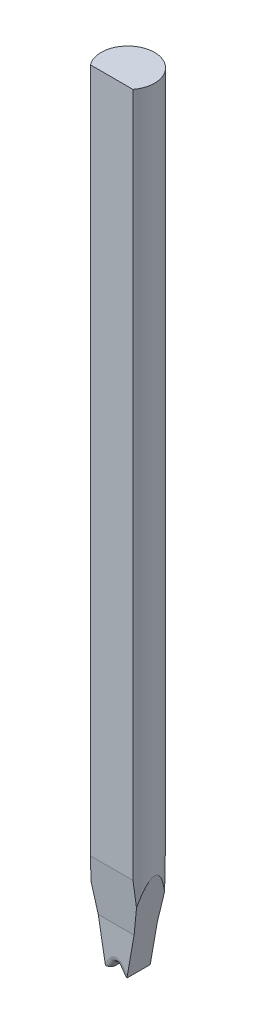
from build123d import *

# Parameters (mm, degrees)
SKETCH_TL_CUTTING_R       = 0.99695
TL_CUTTING_DEPTH          = 29.0068
SKETCH_TDF_GRINDING_W     = 2.0139
SKETCH_TDF_GRINDING_H     = 2.0139
TDF_GRINDING_DEPTH        = 30.041044486
ENGRAVING_DEPTH           = 0.005
VW_VR_GRINDING_DEPTH      = 1.00695
VW_VR_GRINDING_DEPTH_BACK = 1.00695
ISA_GRINDING_DEPTH        = 1.00695
ISA_GRINDING_DEPTH_BACK   = 1.00695
PRE_FRX_BRX_DEPTH         = 1.00695
PRE_FRX_BRX_DEPTH_BACK    = 1.00695
SKETCH_PRE_FRX_BRX_W      = 0.57134
SKETCH_PRE_FRX_BRX_H      = 1.524
FR_EDM_R                  = 0.20066
BR_EDM_R                  = 0.20066
FA_BA_GRINDING_DEPTH      = 1.00695
FA_BA_GRINDING_DEPTH_BACK = 1.00695


with BuildPart() as part:
    # sketch_TL_cutting → TL_cutting (new body)
    with BuildSketch(Plane(origin=(0, 0, 0), x_dir=(1, 0, 0), z_dir=(0, 1, 0))):
        Circle(SKETCH_TL_CUTTING_R)
    extrude(amount=TL_CUTTING_DEPTH)

    # sketch_TDF_grinding → TDF_grinding (cut, through all)
    with BuildSketch(Plane(origin=(0, 0, 0), x_dir=(1, 0, 0), z_dir=(0, 1, 0))):
        with Locations((0, -1.6102)):
            Rectangle(SKETCH_TDF_GRINDING_W, SKETCH_TDF_GRINDING_H)
    extrude(amount=TDF_GRINDING_DEPTH, mode=Mode.SUBTRACT)

    # sketch_engraving → engraving (cut)
    # profile 1 of 4: a face of its own
    with BuildSketch(Plane.XY.offset(0.60325)):
        with BuildLine():
            Line((-0.871794872, -2.249610256), (-0.807692308, -2.057302564))
            add(Edge.make_bspline(
                [(-0.807692308, -2.057302564), (-0.795083199, -2.06121087), (-0.770390599, -2.068864563), (-0.734999856, -2.082917641), (-0.702203082, -2.098988566), (-0.671609756, -2.116493058), (-0.6440337, -2.136542577), (-0.618512481, -2.157904321), (-0.595846404, -2.18153144), (-0.575501226, -2.206851949), (-0.557609249, -2.234023228), (-0.542137322, -2.262995768), (-0.529122858, -2.293719832), (-0.518507427, -2.326238118), (-0.510028384, -2.360428836), (-0.504422472, -2.396434221), (-0.500623034, -2.434090947), (-0.50021097, -2.459803301), (-0.5, -2.472967628)],
                knots=[0, 0, 0, 0, 1.126731846, 2.206495396, 3.246709377, 4.243024494, 5.211217468, 6.153555546, 7.080823308, 8.001390448, 8.923174699, 9.854062736, 10.801713968, 11.767975006, 12.771764216, 13.805490997, 14.876445307, 16, 16, 16, 16], degree=3))
            add(Edge.make_bspline(
                [(-0.5, -2.472967628), (-0.500335891, -2.489216381), (-0.500996599, -2.521178163), (-0.507650823, -2.567918239), (-0.518025882, -2.612463234), (-0.532414864, -2.654859055), (-0.551397758, -2.694919282), (-0.574583683, -2.732730686), (-0.601797497, -2.768403052), (-0.632954709, -2.801556323), (-0.667737286, -2.831589127), (-0.705863815, -2.857840981), (-0.747111378, -2.879847677), (-0.791322431, -2.898010762), (-0.838654677, -2.9120057), (-0.889022656, -2.921872894), (-0.942422085, -2.928033707), (-0.979015843, -2.928736665), (-0.997796474, -2.929097436)],
                knots=[0, 0, 0, 0, 1.025143361, 2.016487647, 2.973470535, 3.909229238, 4.836912068, 5.765858094, 6.70417655, 7.664375231, 8.632718049, 9.599637839, 10.580278406, 11.578303177, 12.611869726, 13.690654642, 14.814798883, 16, 16, 16, 16], degree=3))
            add(Edge.make_bspline(
                [(-0.997796474, -2.929097436), (-1.017578527, -2.928738492), (-1.056169701, -2.928038259), (-1.112278886, -2.921863082), (-1.165155112, -2.912269636), (-1.214486066, -2.898197789), (-1.260619603, -2.880395166), (-1.303180538, -2.858312512), (-1.342406952, -2.832257423), (-1.378079579, -2.802485518), (-1.409638387, -2.769166779), (-1.437292633, -2.733358276), (-1.460718252, -2.695027092), (-1.479834361, -2.654102914), (-1.494642319, -2.610629436), (-1.505301296, -2.564674908), (-1.511506444, -2.516206506), (-1.512376497, -2.483068233), (-1.512820513, -2.466156731)],
                knots=[0, 0, 0, 0, 1.21258364, 2.365529433, 3.456816616, 4.503979614, 5.50606293, 6.48392428, 7.437774563, 8.388174149, 9.326458891, 10.246094529, 11.157518439, 12.075155987, 13.009968439, 13.968342023, 14.963181076, 16, 16, 16, 16], degree=3))
            add(Edge.make_bspline(
                [(-1.512820513, -2.466156731), (-1.512450536, -2.451386542), (-1.511725146, -2.42242762), (-1.506737219, -2.380032682), (-1.498143416, -2.339787486), (-1.486006252, -2.301738502), (-1.470888062, -2.265621156), (-1.45186339, -2.231865567), (-1.429612214, -2.200072504), (-1.412207335, -2.180924346), (-1.403445513, -2.171284936)],
                knots=[0, 0, 0, 0, 1.098573301, 2.153899152, 3.169959448, 4.154852821, 5.120726819, 6.076884781, 7.031881026, 8, 8, 8, 8], degree=3))
            add(Edge.make_bspline(
                [(-1.403445513, -2.171284936), (-1.397871829, -2.165696913), (-1.386593541, -2.154389607), (-1.367544628, -2.139304562), (-1.3470244, -2.124912925), (-1.324614076, -2.111796601), (-1.300431258, -2.099741822), (-1.274575858, -2.088805886), (-1.246999061, -2.078651885), (-1.227800808, -2.073015524), (-1.217948718, -2.070123077)],
                knots=[0, 0, 0, 0, 0.885321605, 1.791438769, 2.723025903, 3.697505786, 4.703199598, 5.754404901, 6.847613555, 8, 8, 8, 8], degree=3))
            Line((-1.217948718, -2.070123077), (-1.179487179, -2.262430769))
            add(Edge.make_bspline(
                [(-1.179487179, -2.262430769), (-1.185794883, -2.264065306), (-1.198219404, -2.267284913), (-1.216072758, -2.273799351), (-1.233013997, -2.281271926), (-1.24862817, -2.290533497), (-1.263609908, -2.300371681), (-1.277293975, -2.312019535), (-1.290039001, -2.324733187), (-1.301712723, -2.338604224), (-1.312079256, -2.353467283), (-1.321398123, -2.369036198), (-1.329005231, -2.385593939), (-1.335159363, -2.402920249), (-1.34031914, -2.420946119), (-1.343506574, -2.439832032), (-1.345953493, -2.459415783), (-1.346086083, -2.472758886), (-1.346153846, -2.479578205)],
                knots=[0, 0, 0, 0, 1.051226935, 2.070641259, 3.064374968, 4.034983734, 4.997599858, 5.953980297, 6.92954377, 7.901109626, 8.875958313, 9.851998019, 10.826131395, 11.811470594, 12.818270757, 13.847890818, 14.900111925, 16, 16, 16, 16], degree=3))
            add(Edge.make_bspline(
                [(-1.346153846, -2.479578205), (-1.345964714, -2.488943276), (-1.345595586, -2.507221091), (-1.341480052, -2.533936919), (-1.335736399, -2.559400139), (-1.326965871, -2.58350806), (-1.315748437, -2.606111388), (-1.302112392, -2.62746701), (-1.286116143, -2.647457717), (-1.267570186, -2.666090263), (-1.246139201, -2.682810441), (-1.221778941, -2.697509865), (-1.194212839, -2.709704354), (-1.163711404, -2.71960434), (-1.130202104, -2.727396757), (-1.093641961, -2.732961156), (-1.054005964, -2.736038436), (-1.026581026, -2.736533904), (-1.012419872, -2.736789744)],
                knots=[0, 0, 0, 0, 0.938194206, 1.831074359, 2.704771284, 3.551924377, 4.396294915, 5.230222094, 6.087631332, 6.958733431, 7.860107878, 8.806247581, 9.804197948, 10.875520245, 12.017191412, 13.250061517, 14.580040491, 16, 16, 16, 16], degree=3))
            add(Edge.make_bspline(
                [(-1.012419872, -2.736789744), (-0.997391019, -2.736536242), (-0.968432733, -2.736047784), (-0.926662344, -2.73297356), (-0.888247277, -2.727365436), (-0.853169898, -2.719717346), (-0.821424949, -2.70970431), (-0.792995162, -2.697493429), (-0.767732206, -2.683211745), (-0.746067503, -2.666272713), (-0.727378117, -2.647679633), (-0.711056153, -2.627854408), (-0.697322329, -2.606598135), (-0.685986727, -2.584069326), (-0.677425368, -2.560082675), (-0.671212847, -2.534852544), (-0.667264371, -2.508281648), (-0.666868694, -2.490075783), (-0.666666667, -2.480780128)],
                knots=[0, 0, 0, 0, 1.475358314, 2.842788217, 4.10813974, 5.28337307, 6.36340737, 7.370420267, 8.315974046, 9.203613532, 10.061092951, 10.899546145, 11.719527401, 12.540320428, 13.369705655, 14.21387866, 15.088031885, 16, 16, 16, 16], degree=3))
            add(Edge.make_bspline(
                [(-0.666666667, -2.480780128), (-0.666838366, -2.473897953), (-0.667175987, -2.460365176), (-0.669318845, -2.440362689), (-0.673408178, -2.42116438), (-0.678815582, -2.402676281), (-0.685600279, -2.384826559), (-0.694303681, -2.36788748), (-0.704306948, -2.351525777), (-0.716030011, -2.33608094), (-0.729191388, -2.321346156), (-0.744402659, -2.307907159), (-0.761298333, -2.295441373), (-0.779991322, -2.284106947), (-0.800321623, -2.27352516), (-0.822605992, -2.264522121), (-0.846484303, -2.256134984), (-0.863210655, -2.251823153), (-0.871794872, -2.249610256)],
                knots=[0, 0, 0, 0, 0.980177776, 1.927374078, 2.859849964, 3.771585772, 4.668674471, 5.574490016, 6.479656464, 7.396337719, 8.332153134, 9.288470092, 10.28125149, 11.318486971, 12.398724812, 13.541284404, 14.738150009, 16, 16, 16, 16], degree=3))
        make_face()
    # profile 2 of 4: a face of its own
    with BuildSketch(Plane.XY.offset(0.60325)):
        Polygon((-0.5, -1.890635897), (-1.5, -1.890635897), (-1.5, -1.698328205), (-1.052283654, -1.698328205), (-1.5, -1.276653526), (-1.5, -1.012430769), (-1.11338141, -1.392238462), (-0.5, -0.999610256), (-0.5, -1.255820192), (-0.964543269, -1.538071795), (-0.801482372, -1.698328205), (-0.5, -1.698328205), align=None)
    # profile 3 of 4: a face of its own
    with BuildSketch(Plane.XY.offset(0.60325)):
        Polygon((-0.5, -0.623408333), (-1.5, -0.9932), (-1.5, -0.790075), (-0.756410256, -0.525251282), (-1.5, -0.261429167), (-1.5, -0.057302564), (-0.5, -0.425691987), align=None)
    # profile 4 of 4: a face of its own
    with BuildSketch(Plane.XY.offset(0.60325)):
        with BuildLine():
            Line((-1.5, 0.032441026), (-1.5, 0.399227885))
            add(Edge.make_bspline(
                [(-1.5, 0.399227885), (-1.500005193, 0.409245429), (-1.500015306, 0.428751916), (-1.498840892, 0.457060934), (-1.497659587, 0.483533506), (-1.495294873, 0.508093648), (-1.492816233, 0.530826568), (-1.489678088, 0.551773058), (-1.485656212, 0.570800798), (-1.482484481, 0.582799681), (-1.480969551, 0.588530769)],
                knots=[0, 0, 0, 0, 1.259756885, 2.453039283, 3.563158368, 4.591894114, 5.55549294, 6.43918076, 7.254497783, 8, 8, 8, 8], degree=3))
            add(Edge.make_bspline(
                [(-1.480969551, 0.588530769), (-1.478658657, 0.595708384), (-1.474070843, 0.609958089), (-1.465592291, 0.630623771), (-1.455897456, 0.650523272), (-1.445221027, 0.669805527), (-1.432791142, 0.688047716), (-1.419507546, 0.705704686), (-1.404697373, 0.722367488), (-1.383580895, 0.743829476), (-1.354290216, 0.768485461), (-1.31539256, 0.794189983), (-1.272808111, 0.816131659), (-1.23457225, 0.830984079), (-1.20204049, 0.841053107), (-1.175895839, 0.847665304), (-1.148342095, 0.853201397), (-1.119406564, 0.857821972), (-1.08913132, 0.861382429), (-1.05746656, 0.864039191), (-1.024383005, 0.865332036), (-1.001870483, 0.865624927), (-0.990384615, 0.865774359)],
                knots=[0, 0, 0, 0, 0.745533224, 1.480105594, 2.206678969, 2.934062197, 3.657537805, 4.387942524, 5.117899297, 5.860384491, 7.364627469, 8.893999443, 10.462354305, 12.093384495, 12.943538583, 13.82926703, 14.75916765, 15.722175386, 16.726416397, 17.773350261, 18.863965346, 20, 20, 20, 20], degree=3))
            add(Edge.make_bspline(
                [(-0.990384615, 0.865774359), (-0.970534085, 0.865496935), (-0.932077115, 0.864959475), (-0.876670001, 0.858903199), (-0.825226124, 0.850028096), (-0.793187511, 0.8401284), (-0.777644231, 0.835325641)],
                knots=[0, 0, 0, 0, 1.103196498, 2.137252386, 3.096302735, 4, 4, 4, 4], degree=3))
            add(Edge.make_bspline(
                [(-0.777644231, 0.835325641), (-0.768728873, 0.832143806), (-0.751133124, 0.825863995), (-0.72572199, 0.815026754), (-0.701626098, 0.803229649), (-0.678906693, 0.790347912), (-0.65742577, 0.776517555), (-0.637188545, 0.761714582), (-0.618237898, 0.745927413), (-0.606691037, 0.734450111), (-0.600961538, 0.728755128)],
                knots=[0, 0, 0, 0, 1.090745555, 2.152744224, 3.18177742, 4.181148221, 5.160920147, 6.124449529, 7.06936063, 8, 8, 8, 8], degree=3))
            add(Edge.make_bspline(
                [(-0.600961538, 0.728755128), (-0.592583678, 0.719570071), (-0.575362903, 0.700690096), (-0.554573072, 0.666975962), (-0.535506501, 0.629398051), (-0.526107802, 0.601958599), (-0.521233974, 0.587729487)],
                knots=[0, 0, 0, 0, 0.911101126, 1.872777386, 2.896898885, 4, 4, 4, 4], degree=3))
            add(Edge.make_bspline(
                [(-0.521233974, 0.587729487), (-0.519478684, 0.582009324), (-0.51583567, 0.570137422), (-0.511916655, 0.551317153), (-0.50791615, 0.531200697), (-0.505019647, 0.50965544), (-0.502856188, 0.48672943), (-0.501264564, 0.462413335), (-0.500262764, 0.436696066), (-0.500088887, 0.419060537), (-0.5, 0.410045192)],
                knots=[0, 0, 0, 0, 0.799100722, 1.658492201, 2.566706013, 3.539587476, 4.561478358, 5.643459719, 6.795328357, 8, 8, 8, 8], degree=3))
            Line((-0.5, 0.410045192), (-0.5, 0.032441026))
            Line((-0.5, 0.032441026), (-1.5, 0.032441026))
        make_face()
        with BuildLine():
            Line((-1.333333333, 0.224748718), (-0.666666667, 0.224748718))
            Line((-0.666666667, 0.224748718), (-0.666666667, 0.383001923))
            add(Edge.make_bspline(
                [(-0.666666667, 0.383001923), (-0.666723329, 0.39014664), (-0.666832426, 0.403902951), (-0.667152994, 0.423808684), (-0.668020833, 0.442101885), (-0.668919772, 0.458878386), (-0.670404978, 0.47409451), (-0.671865734, 0.487816465), (-0.673909301, 0.499967868), (-0.675522466, 0.507472873), (-0.676282051, 0.511006731)],
                knots=[0, 0, 0, 0, 1.333384787, 2.567275092, 3.714769766, 4.750907381, 5.701951617, 6.567520054, 7.325492842, 8, 8, 8, 8], degree=3))
            add(Edge.make_bspline(
                [(-0.676282051, 0.511006731), (-0.678490684, 0.519283425), (-0.682792518, 0.535404243), (-0.692382544, 0.558039501), (-0.703951861, 0.578521493), (-0.717863467, 0.59719323), (-0.73544452, 0.61402033), (-0.757929307, 0.628384317), (-0.784745589, 0.641677808), (-0.810415477, 0.650781194), (-0.83334322, 0.657315587), (-0.852587041, 0.661738835), (-0.873406909, 0.665234409), (-0.895720657, 0.668241058), (-0.919499588, 0.670670501), (-0.944829574, 0.672182216), (-0.971679608, 0.673213971), (-0.990116473, 0.673380839), (-0.999599359, 0.673466667)],
                knots=[0, 0, 0, 0, 1.038686998, 2.023088296, 2.974059649, 3.888265163, 4.839857954, 5.909819677, 7.113156087, 8.466843969, 9.20827164, 10.006482943, 10.861893492, 11.769681931, 12.739021491, 13.762258324, 14.849031541, 16, 16, 16, 16], degree=3))
            add(Edge.make_bspline(
                [(-0.999599359, 0.673466667), (-1.009082274, 0.673381499), (-1.027452468, 0.673216514), (-1.054102295, 0.672186341), (-1.079033407, 0.670683121), (-1.102276607, 0.668236362), (-1.123864073, 0.665276365), (-1.143813894, 0.661739702), (-1.16199574, 0.657343599), (-1.183594173, 0.650801578), (-1.207883412, 0.640901291), (-1.234438517, 0.627332565), (-1.257232167, 0.61090044), (-1.27688009, 0.592507641), (-1.293111332, 0.57147707), (-1.306378823, 0.547988099), (-1.316953256, 0.521928288), (-1.321421865, 0.50333359), (-1.323717949, 0.493779167)],
                knots=[0, 0, 0, 0, 1.117823293, 2.165434315, 3.143494066, 4.061427509, 4.919678676, 5.711704341, 6.448619854, 7.123390005, 8.370176443, 9.535594722, 10.629948309, 11.671122838, 12.697675254, 13.748180153, 14.842958265, 16, 16, 16, 16], degree=3))
            add(Edge.make_bspline(
                [(-1.323717949, 0.493779167), (-1.324486162, 0.489644853), (-1.326177474, 0.480542677), (-1.328152936, 0.465438492), (-1.329618897, 0.447717918), (-1.331115515, 0.427290617), (-1.331969738, 0.404239304), (-1.332861258, 0.378467524), (-1.333165799, 0.350083121), (-1.333275884, 0.330250784), (-1.333333333, 0.319900962)],
                knots=[0, 0, 0, 0, 0.578738571, 1.274160813, 2.095454135, 3.025967819, 4.093109015, 5.270126069, 6.575371698, 8, 8, 8, 8], degree=3))
            Line((-1.333333333, 0.319900962), (-1.333333333, 0.224748718))
        make_face(mode=Mode.SUBTRACT)
    extrude(amount=-ENGRAVING_DEPTH, mode=Mode.SUBTRACT)

    # sketch_VW_VR_grinding → VW_VR_grinding (cut, two sides: drawn at the far end of the back side and taken through both)
    with BuildSketch(Plane.XY.offset(-VW_VR_GRINDING_DEPTH_BACK)):
        with BuildLine():
            Line((-0.99195, -0.01), (-0.99195, 1.509))
            ThreePointArc((-0.99195, 1.509), (-0.993414466, 1.512535534), (-0.99695, 1.514))
            Line((-0.99695, 1.514), (-1.00695, 1.514))
            Line((-1.00695, 1.514), (-1.00695, -0.01))
            Line((-1.00695, -0.01), (-0.99195, -0.01))
        make_face()
        with BuildLine():
            Line((0.99195, -0.01), (0.99195, 1.509))
            ThreePointArc((0.99195, 1.509), (0.993414466, 1.512535534), (0.99695, 1.514))
            Line((0.99695, 1.514), (1.00695, 1.514))
            Line((1.00695, 1.514), (1.00695, -0.01))
            Line((1.00695, -0.01), (0.99195, -0.01))
        make_face()
    extrude(amount=VW_VR_GRINDING_DEPTH + VW_VR_GRINDING_DEPTH_BACK, mode=Mode.SUBTRACT)

    # sketch_ISA_grinding → ISA_grinding (cut, two sides: drawn at the far end of the back side and taken through both)
    with BuildSketch(Plane.XY.offset(-ISA_GRINDING_DEPTH_BACK)):
        Polygon((-0.40005, 0), (-1.00695, 3.441900936), (-1.00695, -0.01), (1.00695, -0.01), (1.00695, 3.441900936), (0.40005, 0), align=None)
    extrude(amount=ISA_GRINDING_DEPTH + ISA_GRINDING_DEPTH_BACK, mode=Mode.SUBTRACT)

    # sketch_pre_FRX_BRX → pre_FRX_BRX (cut, two sides: drawn at the far end of the back side and taken through both)
    with BuildSketch(Plane(origin=(0, 0, 0), x_dir=(0, 0, -1), z_dir=(1, 0, 0)).offset(-PRE_FRX_BRX_DEPTH_BACK)):
        with Locations((-0.72128, 0.752)):
            Rectangle(SKETCH_PRE_FRX_BRX_W, SKETCH_PRE_FRX_BRX_H)
        with Locations((0.72128, 0.752)):
            Rectangle(SKETCH_PRE_FRX_BRX_W, SKETCH_PRE_FRX_BRX_H)
    extrude(amount=PRE_FRX_BRX_DEPTH + PRE_FRX_BRX_DEPTH_BACK, mode=Mode.SUBTRACT)

    # V-Groove_EDM: sweep along a path in sketch_contour_V-Groove
    with BuildLine(Plane(origin=(0, 0, 0), x_dir=(0, 0, -1), z_dir=(1, 0, 0))) as v_groove_edm_path:
        Line((-0.60325, 0.254), (0, 0.254))
        Line((0, 0.254), (0.99695, 0.254))
    # sketch_section_V-Groove → V-Groove_EDM (sweep, cut)
    with BuildSketch(Plane.XY.offset(0.60325)):
        with BuildLine():
            Line((-1.998237147, -2.54), (-0.065865638, 0.219712519))
            ThreePointArc((-0.065865638, 0.219712519), (0, 0.254), (0.065865638, 0.219712519))
            Line((0.065865638, 0.219712519), (1.998237147, -2.54))
            Line((1.998237147, -2.54), (-1.998237147, -2.54))
        make_face()
    sweep(path=v_groove_edm_path.line, mode=Mode.SUBTRACT)

    # FR_EDM
    fr_edm_edges = [part.edges().sort_by_distance(p)[0] for p in [
        (0.142787819, 0.10985626, 0.43561),
        (0, 0.254, 0.43561),
        (-0.142787819, 0.10985626, 0.43561),
    ]]
    fillet(fr_edm_edges, radius=FR_EDM_R)

    # BR_EDM
    br_edm_edges = [part.edges().sort_by_distance(p)[0] for p in [
        (0.142787819, 0.10985626, -0.43561),
        (0, 0.254, -0.43561),
        (-0.142787819, 0.10985626, -0.43561),
    ]]
    fillet(br_edm_edges, radius=BR_EDM_R)

    # sketch_FA_BA_grinding → FA_BA_grinding (cut, two sides: drawn at the far end of the back side and taken through both)
    with BuildSketch(Plane(origin=(0, 0, 0), x_dir=(0, 0, -1), z_dir=(1, 0, 0)).offset(-FA_BA_GRINDING_DEPTH_BACK)):
        Polygon((1.99695, 19.370197862), (1.99695, -0.1), (0.43561, -0.1), (0.43561, 1.524), align=None)
        Polygon((-2.281582645, 22.623563881), (-0.43561, 1.524), (-0.43561, -0.1), (-2.281582645, -0.1), align=None)
    extrude(amount=FA_BA_GRINDING_DEPTH + FA_BA_GRINDING_DEPTH_BACK, mode=Mode.SUBTRACT)


solid = part.part
